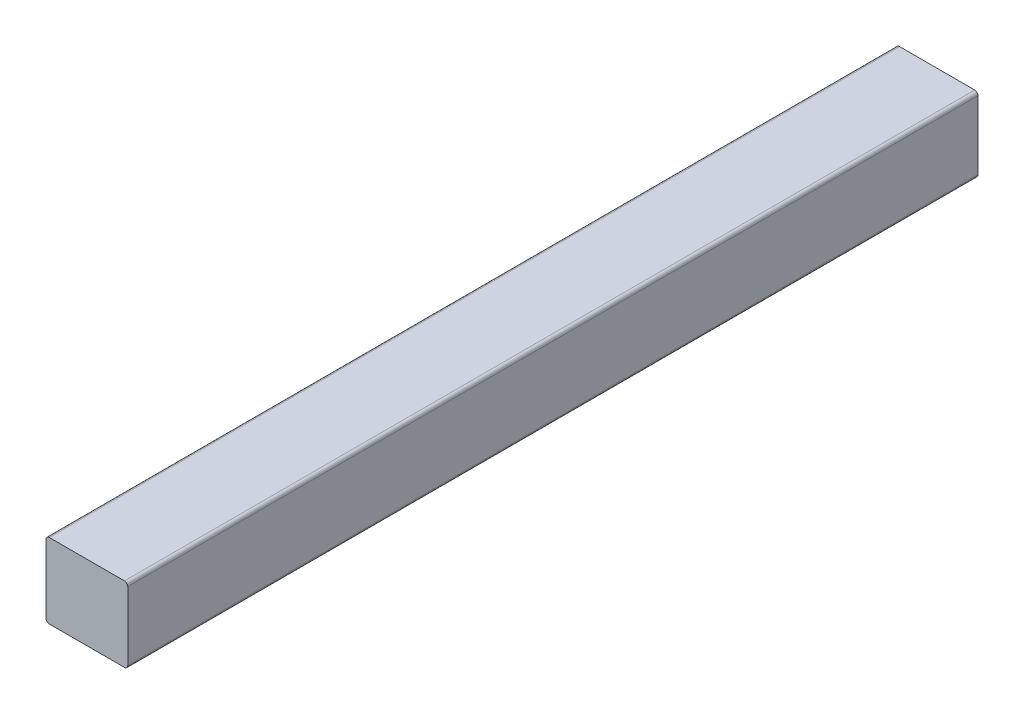
from build123d import *

# Parameters (mm, degrees)
BOSS_EXTRUDE1_DEPTH = 520


with BuildPart() as part:
    # Sketch1 → Boss-Extrude1 (new body)
    with BuildSketch(Plane.XY):
        with BuildLine():
            Line((2, 0), (48, 0))
            ThreePointArc((48, 0), (49.414213562, 0.585786438), (50, 2))
            Line((50, 2), (50, 43.82575695))
            ThreePointArc((50, 43.82575695), (49.414213562, 45.239970512), (48, 45.82575695))
            Line((48, 45.82575695), (2, 45.82575695))
            ThreePointArc((2, 45.82575695), (0.585786438, 45.239970512), (0, 43.82575695))
            Line((0, 43.82575695), (0, 2))
            ThreePointArc((0, 2), (0.585786438, 0.585786438), (2, 0))
        make_face()
    extrude(amount=BOSS_EXTRUDE1_DEPTH)


solid = part.part
